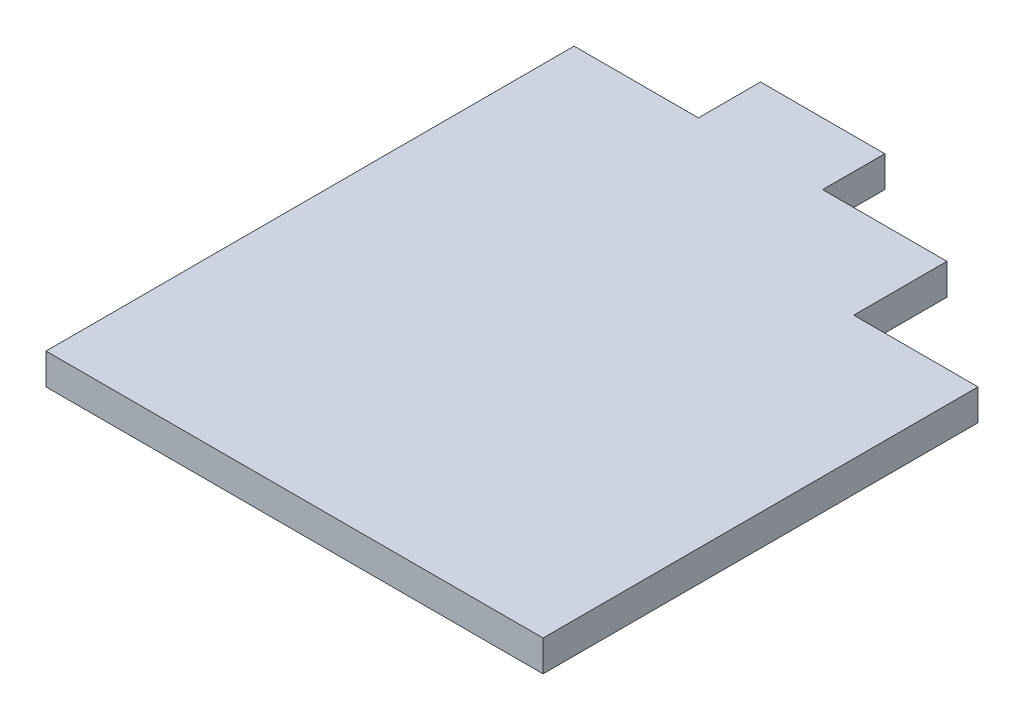
from build123d import *

# Parameters (mm, degrees)
BOSS_EXTRUDE1_DEPTH = 5


with BuildPart() as part:
    # Sketch1 → Boss-Extrude1 (new body)
    with BuildSketch(Plane(origin=(0, 0, 0), x_dir=(1, 0, 0), z_dir=(0, 1, 0))):
        Polygon((0, 0), (80, 0), (80, 70), (60, 70), (60, 85), (40, 85), (40, 95), (20, 95), (20, 85), (0, 85), align=None)
    extrude(amount=BOSS_EXTRUDE1_DEPTH)


solid = part.part
